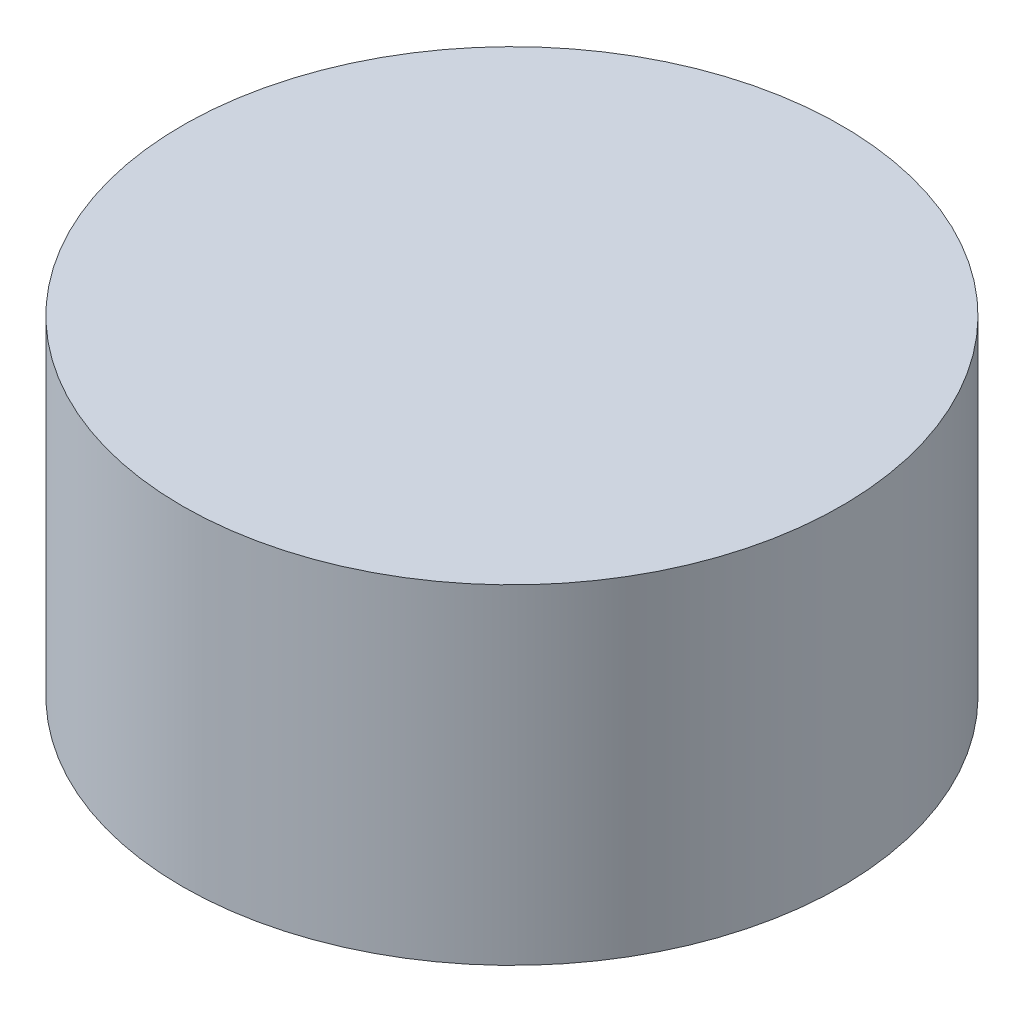
from build123d import *

# Parameters (mm, degrees)
SKETCH1_R           = 3.175
BOSS_EXTRUDE1_DEPTH = 3.175


with BuildPart() as part:
    # Sketch1 → Boss-Extrude1 (new body)
    with BuildSketch(Plane(origin=(0, 0, 0), x_dir=(1, 0, 0), z_dir=(0, 1, 0))):
        Circle(SKETCH1_R)
    extrude(amount=BOSS_EXTRUDE1_DEPTH)


solid = part.part
